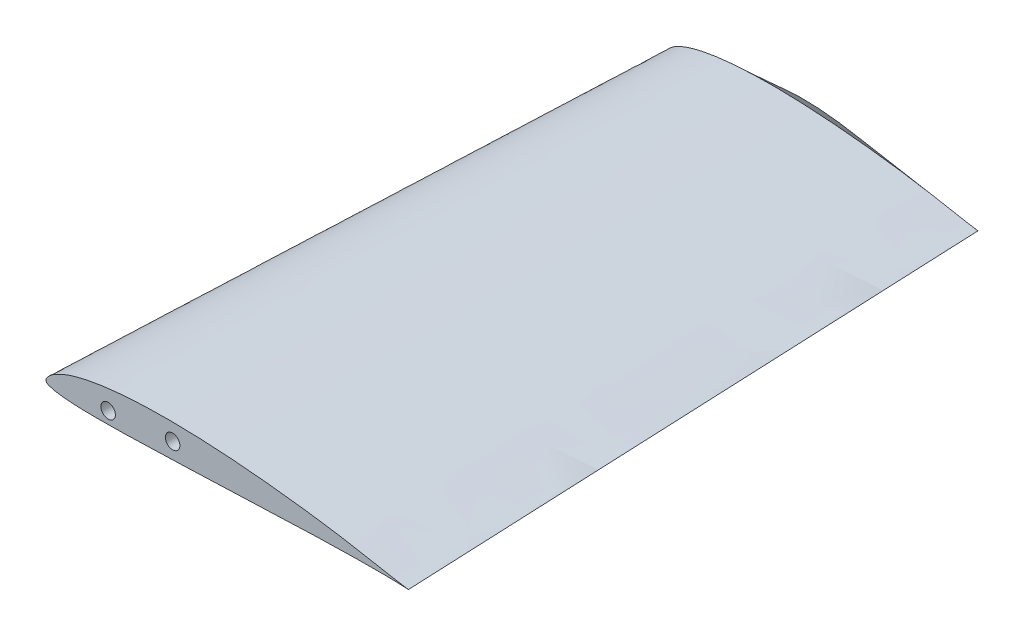
from build123d import *

# Parameters (mm, degrees)
SKETCH9_R          = 3.556
CUT_EXTRUDE2_DEPTH = 152.4


with BuildPart() as part:
    # Sketch2 → Loft1 section 0
    with BuildSketch(Plane.XY):
        with BuildLine():
            add(Edge.make_bspline(
                [(177.8, 0), (177.800804993, 0.005892616), (176.562555188, 0.148181981), (175.314589905, 0.350764396), (172.323623492, 0.832431756), (168.719198756, 1.487087289), (164.107139704, 2.352270631), (158.773609223, 3.364863695), (152.732842851, 4.475355312), (146.083999505, 5.63330484), (138.882483554, 6.781719749), (131.195184548, 7.885223856), (123.096875712, 8.944697907), (114.673804705, 9.938420976), (106.019152482, 10.848844225), (97.227041943, 11.654623945), (88.388816224, 12.328908821), (79.59712844, 12.853216726), (70.939030395, 13.211485197), (62.498398084, 13.382219859), (54.353565535, 13.360079226), (46.578474705, 13.135851745), (39.241632097, 12.709619296), (32.405908321, 12.081237839), (26.128615202, 11.262016007), (20.45862204, 10.261409284), (15.435164424, 9.093705947), (11.089936491, 7.779007433), (7.438887895, 6.350809058), (4.510881143, 4.849599711), (2.266564545, 3.345194547), (0.819977588, 1.866343846), (-0.118765985, 0.550909192), (0.106191128, -0.934182278), (1.715714837, -1.632257341), (3.854821006, -2.296231342), (7.035460873, -2.803962828), (11.063560376, -3.205637863), (15.983702933, -3.464607091), (21.728274929, -3.601316803), (28.25355977, -3.618958746), (35.49224838, -3.533186181), (43.369780353, -3.358290712), (51.798894766, -3.112360998), (60.684955304, -2.812208729), (69.924382003, -2.475506797), (79.409671047, -2.108893238), (89.030204618, -1.729847377), (98.674382872, -1.346253068), (108.230902118, -0.972408129), (117.587571848, -0.616648845), (126.634923272, -0.294680131), (135.261857466, -0.018940801), (143.358505551, 0.19199071), (150.812603372, 0.33144352), (157.526693264, 0.402369346), (163.377796906, 0.401680466), (168.351350733, 0.340767754), (172.165898878, 0.2623643), (175.270689088, 0.129847323), (176.552249869, 0.089995509), (177.799197462, -0.005874644), (177.8, 0)],
                knots=[0, 0, 0, 0, 0.001629123, 0.00643167, 0.014224842, 0.024758636, 0.037744289, 0.052909553, 0.069989147, 0.088759678, 0.10901411, 0.130596674, 0.153308112, 0.176896627, 0.201090567, 0.225638076, 0.250277938, 0.27476174, 0.298838354, 0.322298524, 0.344926589, 0.366529425, 0.386941609, 0.406001157, 0.423573574, 0.439544098, 0.453838518, 0.466413062, 0.477252203, 0.486361662, 0.493761334, 0.499502797, 0.503687837, 0.506582908, 0.510585176, 0.51694865, 0.525766101, 0.537029387, 0.550698004, 0.566665463, 0.584800472, 0.604926902, 0.626835723, 0.650291182, 0.675016923, 0.700736096, 0.727137616, 0.753914808, 0.780761308, 0.807360698, 0.833406633, 0.858587559, 0.882606924, 0.905148744, 0.92590319, 0.94458584, 0.960917561, 0.974653917, 0.985584261, 0.993536567, 0.998375846, 1, 1, 1, 1], degree=3))
        make_face()
    # Sketch4 → Loft1 section 1
    with BuildSketch(Plane.XY.offset(-292.1)):
        with BuildLine():
            add(Edge.make_bspline(
                [(165.1, 0), (165.100687331, 0.005051176), (164.039266362, 0.126454007), (162.969490602, 0.299532191), (160.405588193, 0.711038478), (157.315786354, 1.270543137), (153.362203079, 2.010044899), (148.790149293, 2.875571851), (143.61184925, 3.824692292), (137.912319076, 4.814216199), (131.739073964, 5.795317876), (125.149463782, 6.737705112), (118.207579452, 7.642166613), (110.987357329, 8.490123416), (103.568674712, 9.266575763), (96.032217992, 9.953271578), (88.456293396, 10.527236722), (80.920326208, 10.972671238), (73.498939496, 11.275846636), (66.264036663, 11.418377065), (59.282763554, 11.395719503), (52.618503136, 11.200011741), (46.329975214, 10.831354915), (40.471068932, 10.289653967), (35.090903589, 9.584627902), (30.231362874, 8.724403499), (25.926070826, 7.721245573), (22.202184759, 6.592398246), (19.073360667, 5.366578983), (16.564319543, 4.07850558), (14.641299833, 2.788001801), (13.402036652, 1.519762259), (12.597993847, 0.391823024), (12.791485149, -0.881010533), (14.171391913, -1.478633229), (16.005210966, -2.046787184), (18.731702351, -2.480548448), (22.184539593, -2.823021322), (26.40192048, -3.042771936), (31.325899738, -3.157356225), (36.919007455, -3.169529726), (43.123557224, -3.092739923), (49.8756466, -2.939270448), (57.100488701, -2.724665286), (64.716974303, -2.463377211), (72.636328589, -2.170601208), (80.766408454, -1.852075593), (89.012406552, -1.522832619), (97.278669459, -1.189680292), (105.4698005, -0.864924171), (113.489640174, -0.555760329), (121.244365211, -0.275699576), (128.63875361, -0.035453946), (135.578640463, 0.149002554), (141.967802395, 0.271901306), (147.722702953, 0.335728318), (152.73793357, 0.337781413), (157.00100605, 0.287817611), (160.270653265, 0.222338104), (162.931961152, 0.110154917), (164.030459523, 0.076575246), (165.099314765, -0.00503577), (165.1, 0)],
                knots=[0, 0, 0, 0, 0.001629123, 0.00643167, 0.014224842, 0.024758636, 0.037744289, 0.052909553, 0.069989147, 0.088759678, 0.10901411, 0.130596674, 0.153308112, 0.176896627, 0.201090567, 0.225638076, 0.250277938, 0.27476174, 0.298838354, 0.322298524, 0.344926589, 0.366529425, 0.386941609, 0.406001157, 0.423573574, 0.439544098, 0.453838518, 0.466413062, 0.477252203, 0.486361662, 0.493761334, 0.499502797, 0.503687837, 0.506582908, 0.510585176, 0.51694865, 0.525766101, 0.537029387, 0.550698004, 0.566665463, 0.584800472, 0.604926902, 0.626835723, 0.650291182, 0.675016923, 0.700736096, 0.727137616, 0.753914808, 0.780761308, 0.807360698, 0.833406633, 0.858587559, 0.882606924, 0.905148744, 0.92590319, 0.94458584, 0.960917561, 0.974653917, 0.985584261, 0.993536567, 0.998375846, 1, 1, 1, 1], degree=3))
        make_face()
    loft()

    # Loft2: read off the stored shape, not the designer's step
    # Loft2: loft between two sections, ruled curve by curve
    loft2_from = [
        Edge.make_bspline([(127.529412001, 6.392734945, -292.1), (128.570113006, 6.245692912, -292.1), (130.017993587, 6.036410006, -292.1), (133.373817125, 5.53406383, -292.1), (135.843873947, 5.142950106, -292.1), (139.813779419, 4.484094169, -292.1), (142.006301398, 4.103439476, -292.1), (145.646567902, 3.451752708, -292.1), (147.831550805, 3.050753426, -292.1), (150.966421198, 2.463585886, -292.1), (153.317717825, 2.019314918, -292.1), (155.73533208, 1.566160717, -292.1), (158.110634972, 1.12661109, -292.1), (159.795979791, 0.821427027, -292.1), (161.752311875, 0.494889353, -292.1), (163.090968025, 0.279878453, -292.1), (164.039266362, 0.126454007, -292.1), (165.368722075, -0.025606006, -292.1), (164.676677892, 0.027234104, -292.1), (163.835710949, 0.082528457, -292.1), (162.827451903, 0.114560338, -292.1), (161.370621848, 0.175970684, -292.1), (159.360704326, 0.240561174, -292.1), (158.190001455, 0.263546684, -292.1), (156.32051985, 0.293503744, -292.1), (154.94519653, 0.311593267, -292.1), (153.596946597, 0.323001044, -292.1), (152.931326163, 0.327245636, -292.1), (152.594836094, 0.329170406, -292.1), (151.801110633, 0.332816555, -292.1), (150.314126856, 0.335922105, -292.1), (148.92526074, 0.332440528, -292.1), (146.980034988, 0.322351399, -292.1), (144.981545121, 0.305326418, -292.1), (142.508867797, 0.27268114, -292.1), (139.497007085, 0.224374312, -292.1), (137.268536857, 0.179510549, -292.1), (133.658891831, 0.096841465, -292.1), (131.334971329, 0.03598862, -292.1), (127.269640288, -0.082150664, -292.1), (124.485072498, -0.170408141, -292.1), (120.331551632, -0.310790588, -292.1), (117.091128073, -0.425693124, -292.1), (112.938018916, -0.578895871, -292.1), (109.336805726, -0.715851591, -292.1), (105.184021161, -0.87724969, -292.1), (101.317139745, -1.029565903, -292.1), (97.164508416, -1.194932279, -292.1), (93.126119037, -1.357039091, -292.1), (88.973552656, -1.52400062, -292.1), (84.859793671, -1.688636516, -292.1), (80.707149219, -1.853654836, -292.1), (76.613670777, -2.014774281, -292.1), (72.460842294, -2.175096296, -292.1), (68.483240922, -2.324139535, -292.1), (64.330042745, -2.474633272, -292.1), (60.563485534, -2.605865117, -292.1), (56.409811017, -2.742574301, -292.1), (52.946386144, -2.848057859, -292.1), (48.792000114, -2.961509921, -292.1), (45.720718349, -3.033708573, -292.1), (41.565522095, -3.110912786, -292.1), (38.967960177, -3.144171129, -292.1), (35.022161918, -3.165401207, -292.1), (32.762510624, -3.160483035, -292.1), (29.246519696, -3.108967662, -292.1), (26.961811518, -3.051267606, -292.1), (24.116353986, -2.923680335, -292.1), (21.612164399, -2.764063326, -292.1), (19.695120014, -2.576105925, -292.1), (17.632214194, -2.305629365, -292.1), (16.005210966, -2.046787184, -292.1), (14.536096394, -1.591625998, -292.1), (13.48973838, -1.183416456, -292.1), (12.788217253, -0.859513511, -292.1), (12.597993847, 0.391823024, -292.1), (13.215909605, 1.258656759, -292.1), (13.899743176, 2.029106121, -292.1), (14.880993271, 2.948855736, -292.1), (15.854428945, 3.602110827, -292.1), (17.325357793, 4.469201897, -292.1), (18.218413154, 4.922571583, -292.1), (19.644131577, 5.568034386, -292.1), (20.678489023, 5.99386834, -292.1), (21.683577831, 6.360642649, -292.1), (22.355370953, 6.59555106, -292.1), (23.060010811, 6.833913064, -292.1), (24.284837079, 7.218005313, -292.1), (25.269776614, 7.497802456, -292.1), (26.578575721, 7.849902155, -292.1), (28.009361762, 8.20611316, -292.1), (29.673108729, 8.569648308, -292.1), (31.689999602, 8.976291484, -292.1), (33.311861148, 9.264825728, -292.1), (35.696847934, 9.642924724, -292.1), (37.750745846, 9.933178179, -292.1), (40.242013302, 10.233225884, -292.1), (42.969907499, 10.520690812, -292.1), (45.305216257, 10.723054098, -292.1), (48.670115232, 10.968542601, -292.1), (50.857371268, 11.091174575, -292.1), (54.63155066, 11.256573884, -292.1), (56.858561827, 11.323525246, -292.1), (60.928558307, 11.395234947, -292.1), (63.439076997, 11.409208723, -292.1), (67.595040505, 11.384014858, -292.1), (70.419487522, 11.33651305, -292.1), (74.573926046, 11.222016017, -292.1), (77.651667215, 11.106201133, -292.1), (81.803062082, 10.910343857, -292.1), (85.069210428, 10.727439778, -292.1), (89.216555225, 10.459505848, -292.1), (92.600516312, 10.21326323, -292.1), (96.743033331, 9.878983746, -292.1), (100.171135676, 9.576147744, -292.1), (104.308299388, 9.181195148, -292.1), (107.702133239, 8.833960737, -292.1), (111.833680765, 8.384154839, -292.1), (115.115019167, 8.005362854, -292.1), (119.240435787, 7.502446055, -292.1), (122.328786982, 7.105212471, -292.1), (125.405747121, 6.689562378, -292.1), (126.774132281, 6.499449424, -292.1), (127.529412001, 6.392734945, -292.1)], [0, 0, 0, 0, 0.010191888, 0.01418589, 0.032903326, 0.034440322, 0.053210853, 0.05448589, 0.070290447, 0.074740322, 0.085455711, 0.093510853, 0.098441364, 0.108975158, 0.110590447, 0.11676833, 0.121570877, 0.1232, 0.124824154, 0.125755711, 0.129663433, 0.137615739, 0.138741364, 0.148546083, 0.149275158, 0.15706833, 0.161870877, 0.162282439, 0.1635, 0.165124154, 0.169963433, 0.177915739, 0.17861416, 0.188846083, 0.19729681, 0.202582439, 0.218051256, 0.21891416, 0.23759681, 0.240593076, 0.258351256, 0.264612441, 0.280893076, 0.289793367, 0.304912441, 0.315839302, 0.330093367, 0.342438692, 0.356139302, 0.369285192, 0.382738692, 0.396062384, 0.409585192, 0.422463904, 0.436362384, 0.448183077, 0.462763904, 0.472908818, 0.488483077, 0.496364277, 0.513208818, 0.518273098, 0.536664277, 0.538399528, 0.556534537, 0.558573098, 0.572501996, 0.578699528, 0.586170613, 0.596834537, 0.597433899, 0.60625135, 0.612614824, 0.612801996, 0.616617092, 0.619512163, 0.623697203, 0.626470613, 0.629438666, 0.636838338, 0.637733899, 0.645947797, 0.64655135, 0.652914824, 0.656786938, 0.656917092, 0.659812163, 0.663997203, 0.669361482, 0.669738666, 0.677138338, 0.683655902, 0.686247797, 0.697086938, 0.699626426, 0.709661482, 0.717198843, 0.723955902, 0.736258391, 0.739926426, 0.756670575, 0.757498843, 0.776558391, 0.778273411, 0.796970575, 0.800901476, 0.818573411, 0.824361646, 0.841201476, 0.84843826, 0.864661646, 0.872922062, 0.88873826, 0.897561924, 0.913222062, 0.922109433, 0.937861924, 0.946303373, 0.962409433, 0.969891888, 0.986603373, 0.992603326, 1, 1, 1, 1], 3),
    ]
    loft2_to = [
        Edge.make_bspline([(89.336773533, -3.870265327, -306.798834605), (89.858650748, -3.923763997, -306.767947134), (90.584805372, -3.999954826, -306.723958338), (92.268270456, -4.182328559, -306.618664814), (93.507940106, -4.323436028, -306.537196379), (95.501475867, -4.560389702, -306.400391111), (96.60309869, -4.697025749, -306.321504253), (98.431013113, -4.935631349, -306.183745245), (99.527732109, -5.084967826, -306.09752579), (101.103281047, -5.309922742, -305.967648009), (102.283377577, -5.484251448, -305.866999283), (103.486950216, -5.668226465, -305.760781258), (104.680947712, -5.854360746, -305.65331658), (105.547301592, -5.992269075, -305.57369517), (106.47558657, -6.141933725, -305.487286244), (107.112935124, -6.245495312, -305.427494934), (107.751566426, -6.349738932, -305.367309852), (108.160217402, -6.416427305, -305.328807301), (108.372712686, -6.451083462, -305.30879856), (108.701210397, -6.504612068, -305.277893805), (109.35255808, -6.610530068, -305.216742019), (110.012450932, -6.716957554, -305.155296081), (110.960577187, -6.86811445, -305.068025607), (111.536466074, -6.958521222, -305.015829233), (112.500362103, -7.099994298, -304.934149714), (113.238887631, -7.202647175, -304.874883048), (113.727992311, -7.27117738, -304.835317116), (114.204018683, -7.320209511, -304.807008401), (114.404473512, -7.341185947, -304.794897651), (113.769372091, -7.299190365, -304.819143811), (113.220122906, -7.28464994, -304.827538729), (112.463416759, -7.257025687, -304.843487599), (111.455905417, -7.228553714, -304.859925901), (110.483523217, -7.2118945, -304.869544102), (109.247010088, -7.197492302, -304.877859215), (107.733153682, -7.186561838, -304.884169922), (106.62086813, -7.186617361, -304.884137866), (104.81736404, -7.194639828, -304.879506092), (103.654295351, -7.205811102, -304.873056354), (101.620646558, -7.233225785, -304.857228479), (100.228171042, -7.257035157, -304.843482132), (98.150877959, -7.299883273, -304.81874376), (96.530174337, -7.33830445, -304.796561283), (94.453165492, -7.393292956, -304.764813655), (92.652263868, -7.444988169, -304.73496741), (90.575580986, -7.508050589, -304.698558305), (88.641930878, -7.569397879, -304.66313943), (86.565459804, -7.637550021, -304.623791773), (84.546160008, -7.705414712, -304.584610075), (82.469807437, -7.776203135, -304.54374036), (80.412909986, -7.847114996, -304.502799378), (78.336620817, -7.9192858, -304.461131545), (76.289951343, -7.990555781, -304.419983802), (74.213652997, -8.062525482, -304.378432076), (72.225027193, -8.130976448, -304.338911892), (70.148675463, -8.201795714, -304.29802437), (68.265664858, -8.264868698, -304.261609166), (66.189173315, -8.332537995, -304.222540279), (64.457808482, -8.387167154, -304.191000119), (62.381131065, -8.450464023, -304.154455655), (60.845951043, -8.495072589, -304.128700887), (58.769016908, -8.551659306, -304.096030531), (57.470665599, -8.584182763, -304.077253104), (55.49846357, -8.628300593, -304.051781663), (54.369066778, -8.650434739, -304.039002508), (52.61095156, -8.677589734, -304.023324565), (51.468189929, -8.691348533, -304.015380918), (50.0451975, -8.700070756, -304.01034514), (48.7904577, -8.702112453, -304.009166366), (47.824468886, -8.69642752, -304.012448564), (46.789271753, -8.684090294, -304.019571465), (45.975901498, -8.67020454, -304.027588408), (45.18377081, -8.648059877, -304.040373635), (44.649434369, -8.630185066, -304.050693662), (44.293868862, -8.617091547, -304.058253209), (43.732502378, -8.592426206, -304.07249375), (43.225337864, -8.565735651, -304.08790355), (42.715299062, -8.533672711, -304.106415097), (42.041309856, -8.484969837, -304.134533714), (41.464416637, -8.431944088, -304.165148144), (40.616517178, -8.336315098, -304.220359567), (40.115910369, -8.268117669, -304.259733372), (39.364143681, -8.113292846, -304.349121525), (38.846059336, -7.974284571, -304.42937799), (38.307285836, -7.772872945, -304.545663046), (38.11608258, -7.521267729, -304.690927385), (38.053139254, -7.162684072, -304.897955756), (38.443334044, -6.688640096, -305.171645173), (38.796670528, -6.371600482, -305.35468808), (39.306597626, -5.990388967, -305.574780651), (39.924299143, -5.631396905, -305.782044814), (40.67471387, -5.282469743, -305.983498005), (41.60432726, -4.902181387, -306.20305759), (42.372533423, -4.641533797, -306.353542546), (43.515841893, -4.304330825, -306.548226773), (44.510579595, -4.048989244, -306.695648304), (45.727782996, -3.785022065, -306.848049825), (47.067852048, -3.530924028, -306.994753395), (48.220742366, -3.347472677, -307.100669082), (49.886566206, -3.116530703, -307.234003493), (50.972617167, -2.992219022, -307.305774875), (52.849558169, -2.807946241, -307.412164815), (53.958953161, -2.719116197, -307.463450865), (55.98865409, -2.587934826, -307.539188465), (57.241957783, -2.525602849, -307.575175848), (59.318196776, -2.450688471, -307.618427685), (60.730162989, -2.417618541, -307.637520618), (62.80800394, -2.393887118, -307.651221961), (64.348009401, -2.393401362, -307.651502413), (66.425886648, -2.414315443, -307.639427663), (68.0611247, -2.446771745, -307.620689008), (70.137941574, -2.507583742, -307.585579185), (71.832785067, -2.572099448, -307.548331025), (73.907846918, -2.667732865, -307.493117045), (75.625281039, -2.760091502, -307.439793762), (77.698139868, -2.88650089, -307.366811268), (79.398693421, -3.002158486, -307.300036324), (81.469020844, -3.156504, -307.210924899), (83.113426605, -3.289599906, -307.134081942), (85.181091731, -3.468689337, -307.030684611), (86.729203347, -3.611689748, -306.948123285), (88.271887547, -3.76230201, -306.861167255), (88.958025675, -3.831439132, -306.821250919), (89.336773533, -3.870265327, -306.798834605)], [0, 0, 0, 0, 0.010191888, 0.01418589, 0.032903326, 0.034440322, 0.053210853, 0.05448589, 0.070290447, 0.074740322, 0.085455711, 0.093510853, 0.098441364, 0.108975158, 0.110590447, 0.11676833, 0.121570877, 0.1232, 0.124824154, 0.125755711, 0.129663433, 0.137615739, 0.138741364, 0.148546083, 0.149275158, 0.15706833, 0.161870877, 0.162282439, 0.1635, 0.165124154, 0.169963433, 0.177915739, 0.17861416, 0.188846083, 0.19729681, 0.202582439, 0.218051256, 0.21891416, 0.23759681, 0.240593076, 0.258351256, 0.264612441, 0.280893076, 0.289793367, 0.304912441, 0.315839302, 0.330093367, 0.342438692, 0.356139302, 0.369285192, 0.382738692, 0.396062384, 0.409585192, 0.422463904, 0.436362384, 0.448183077, 0.462763904, 0.472908818, 0.488483077, 0.496364277, 0.513208818, 0.518273098, 0.536664277, 0.538399528, 0.556534537, 0.558573098, 0.572501996, 0.578699528, 0.586170613, 0.596834537, 0.597433899, 0.60625135, 0.612614824, 0.612801996, 0.616617092, 0.619512163, 0.623697203, 0.626470613, 0.629438666, 0.636838338, 0.637733899, 0.645947797, 0.64655135, 0.652914824, 0.656786938, 0.656917092, 0.659812163, 0.663997203, 0.669361482, 0.669738666, 0.677138338, 0.683655902, 0.686247797, 0.697086938, 0.699626426, 0.709661482, 0.717198843, 0.723955902, 0.736258391, 0.739926426, 0.756670575, 0.757498843, 0.776558391, 0.778273411, 0.796970575, 0.800901476, 0.818573411, 0.824361646, 0.841201476, 0.84843826, 0.864661646, 0.872922062, 0.88873826, 0.897561924, 0.913222062, 0.922109433, 0.937861924, 0.946303373, 0.962409433, 0.969891888, 0.986603373, 0.992603326, 1, 1, 1, 1], 3),
    ]
    loft2 = Solid(Shell([*[Face.make_surface_from_curves(loft2_from[k], loft2_to[k]) for k in range(1)], Face(Wire(loft2_from)), Face(Wire(loft2_to))]))
    add(loft2)

    # Sketch9 → Cut-Extrude2 (cut)
    with BuildSketch(Plane.XY):
        with Locations((62.109167659, 5.08)):
            Circle(SKETCH9_R)
        with Locations((30.48, 2.312645085)):
            Circle(SKETCH9_R)
    extrude(amount=-CUT_EXTRUDE2_DEPTH, mode=Mode.SUBTRACT)


solid = part.part
